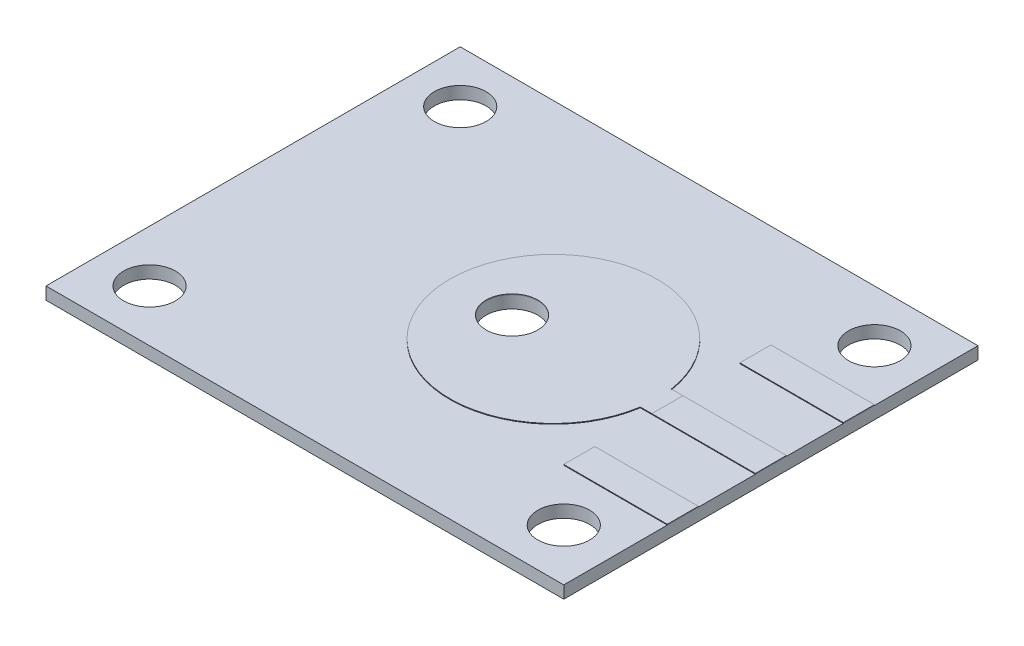
from build123d import *

# Parameters (mm, degrees)
BOSS_EXTRUDE1_START   = -0.635
SKETCH1_W             = 25
SKETCH1_H             = 20
BOSS_EXTRUDE1_DEPTH   = 0.6
SKETCH2_R             = 1.25
CUT_EXTRUDE1_DEPTH    = 0.6
BOSS_EXTRUDE2_START   = 0.035
SKETCH9_W             = 5
SKETCH9_H             = 1.5
BOSS_EXTRUDE2_DEPTH   = 0.2
BOSS_EXTRUDE2_2_DEPTH = 0.2
BOSS_EXTRUDE2_3_DEPTH = 0.2
SKETCH8_R             = 1.25
BOSS_EXTRUDE3_DEPTH   = 0.035


with BuildPart() as part:
    # Sketch1 → Boss-Extrude1 (new body)
    with BuildSketch(Plane(origin=(0, 0, 0), x_dir=(1, 0, 0), z_dir=(0, 1, 0)).offset(BOSS_EXTRUDE1_START)):
        Rectangle(SKETCH1_W, SKETCH1_H)
    extrude(amount=BOSS_EXTRUDE1_DEPTH)

    # Sketch2 → Cut-Extrude1 (cut)
    with BuildSketch(Plane(origin=(0, -0.035, 0), x_dir=(1, 0, 0), z_dir=(0, 1, 0))):
        with Locations((-10, 7.5)):
            Circle(SKETCH2_R)
        with Locations((10, 7.5)):
            Circle(SKETCH2_R)
        with Locations((10, -7.5)):
            Circle(SKETCH2_R)
        with Locations((-10, -7.5)):
            Circle(SKETCH2_R)
        Circle(SKETCH2_R)
    extrude(amount=-CUT_EXTRUDE1_DEPTH, mode=Mode.SUBTRACT)


with BuildPart() as body_2:
    # Sketch9 → Boss-Extrude2 (new body)
    with BuildSketch(Plane(origin=(0, -0.035, 0), x_dir=(1, 0, 0), z_dir=(0, 1, 0)).offset(BOSS_EXTRUDE2_START)):
        with Locations((10, 4.25)):
            Rectangle(SKETCH9_W, SKETCH9_H)
    extrude(amount=-BOSS_EXTRUDE2_DEPTH)


with BuildPart() as body_3:
    # Sketch9 → Boss-Extrude2 2 (new body)
    with BuildSketch(Plane(origin=(0, -0.035, 0), x_dir=(1, 0, 0), z_dir=(0, 1, 0)).offset(BOSS_EXTRUDE2_START)):
        with Locations((10, 0)):
            Rectangle(SKETCH9_W, SKETCH9_H)
    extrude(amount=-BOSS_EXTRUDE2_2_DEPTH)


with BuildPart() as body_4:
    # Sketch9 → Boss-Extrude2 3 (new body)
    with BuildSketch(Plane(origin=(0, -0.035, 0), x_dir=(1, 0, 0), z_dir=(0, 1, 0)).offset(BOSS_EXTRUDE2_START)):
        with Locations((10, -4.25)):
            Rectangle(SKETCH9_W, SKETCH9_H)
    extrude(amount=-BOSS_EXTRUDE2_3_DEPTH)


with BuildPart() as body_5:
    # Sketch8 → Boss-Extrude3 (new body)
    with BuildSketch(Plane(origin=(0, -0.035, 0), x_dir=(1, 0, 0), z_dir=(0, 1, 0))):
        with BuildLine():
            Line((7.5, 0.75), (6.943429983, 0.75))
            ThreePointArc((6.943429983, 0.75), (-3, 0), (6.943429983, -0.75))
            Line((6.943429983, -0.75), (7.5, -0.75))
            Line((7.5, -0.75), (7.5, 0.75))
        make_face()
        Circle(SKETCH8_R, mode=Mode.SUBTRACT)
    extrude(amount=BOSS_EXTRUDE3_DEPTH)


solid = Compound([part.part, body_2.part, body_3.part, body_4.part, body_5.part])
